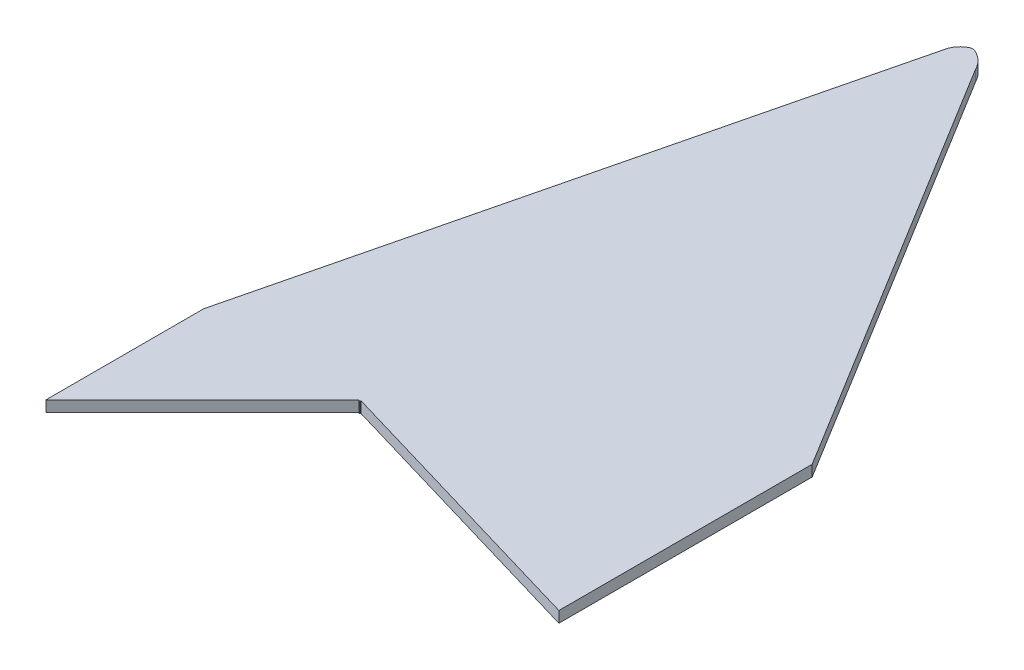
from build123d import *

# Parameters (mm, degrees)
BOSS_EXTRUDE1_DEPTH = 1.27


with BuildPart() as part:
    # Sketch2 → Boss-Extrude1 (new body)
    with BuildSketch(Plane(origin=(0, 0, 0), x_dir=(1, 0, 0), z_dir=(0, 1, 0))):
        with BuildLine():
            Line((-20.521508148, -53.181733362), (-2.543808479, -35.200760259))
            ThreePointArc((-2.543808479, -35.200760259), (-2.501501482, -35.277637659), (-2.413917827, -35.283033929))
            ThreePointArc((-2.413917827, -35.283033929), (-2.385689773, -35.261829399), (-2.367237142, -35.231730305))
            ThreePointArc((-2.367237142, -35.231730305), (-2.363173394, -35.216481669), (-2.361805095, -35.200760259))
            Line((-2.361805095, -35.200760259), (29.835023215, -44.694796912))
            Line((29.835023215, -44.694796912), (29.835023215, -15.630183789))
            Line((29.835023215, -15.630183789), (-0.003843839, 32.928332047))
            ThreePointArc((-0.003843839, 32.928332047), (-0.811493044, 34.041363236), (-1.952874196, 34.80842564))
            ThreePointArc((-1.952874196, 34.80842564), (-2.21587973, 34.863939323), (-2.478885407, 34.808426311))
            ThreePointArc((-2.478885407, 34.808426311), (-3.303043403, 34.188828563), (-3.76901984, 33.269043951))
            Line((-3.76901984, 33.269043951), (-20.521508148, -35.094541102))
            Line((-20.521508148, -35.094541102), (-20.521508148, -53.181733362))
        make_face()
    extrude(amount=BOSS_EXTRUDE1_DEPTH)


solid = part.part
